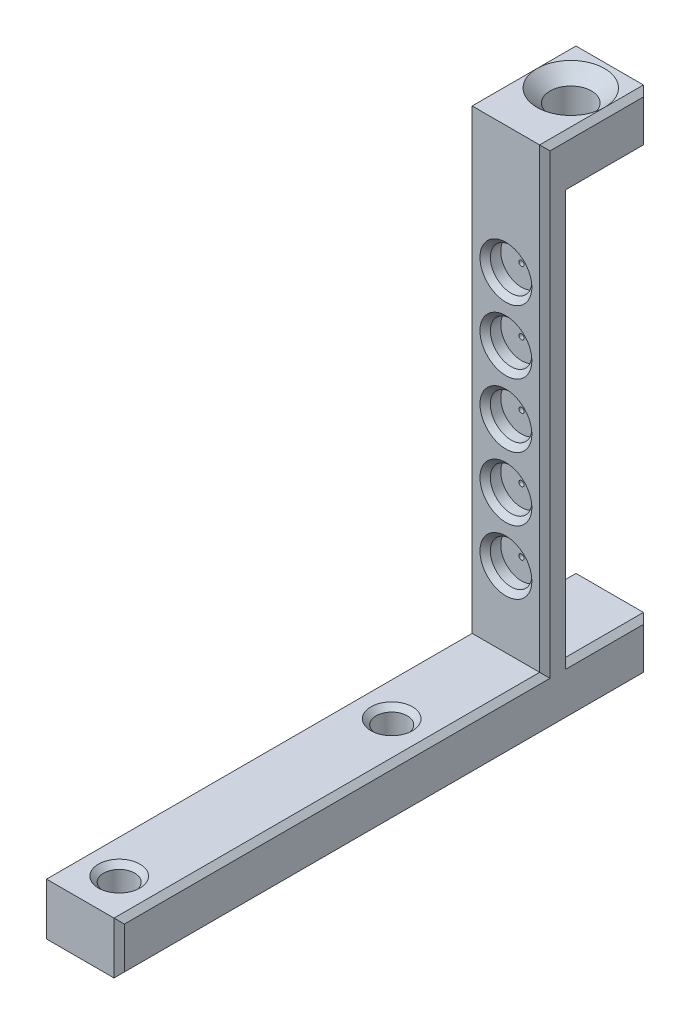
from build123d import *

# Parameters (mm, degrees)
SKETCH1_W           = 15
SKETCH1_H           = 10
SKETCH1_H_2         = 78
BOSS_EXTRUDE1_DEPTH = 5
SKETCH1_3_W         = 15
SKETCH1_3_H         = 10
BOSS_EXTRUDE2_DEPTH = 15
HOLE1_D             = 1
HOLE1_CBORE_D       = 8
HOLE1_CBORE_DEPTH   = 3
SKETCH1_4_W         = 15
SKETCH1_4_H         = 10
BOSS_EXTRUDE3_DEPTH = 87
HOLE2_START         = 41
HOLE2_OUTLINE_R     = 4
HOLE2_DEPTH         = 8
HOLE2_START_2       = 39
HOLE2_2_OUTLINE_R   = 0.5
HOLE2_2_DEPTH       = 2
CUT_EXTRUDE1_REACH  = 125.973
SKETCH9_R           = 3
CHAMFER1_SIZE       = 2.5
CHAMFER2_SIZE       = 1
CHAMFER3_SIZE       = 1


# Read off the part's stored shape, not the designer's step: Hole2
with BuildPart() as part:
    # Sketch1 → Boss-Extrude1 (new body)
    with BuildSketch(Plane.XY):
        with Locations((0, -44)):
            Rectangle(SKETCH1_W, SKETCH1_H)
        Rectangle(SKETCH1_W, SKETCH1_H_2)
        with Locations((0, 44)):
            Rectangle(SKETCH1_W, SKETCH1_H)
    extrude(amount=BOSS_EXTRUDE1_DEPTH)

    # Sketch1<3> → Boss-Extrude2 (add)
    with BuildSketch(Plane.XY):
        with Locations((0, -44)):
            Rectangle(SKETCH1_3_W, SKETCH1_3_H)
        with Locations((0, 44)):
            Rectangle(SKETCH1_3_W, SKETCH1_3_H)
    extrude(amount=-BOSS_EXTRUDE2_DEPTH)

    # Hole1 (through all)
    with Locations(Plane.XY.offset(5)):
        with Locations((0, 24.5), (0, 12.25), (0, 0), (0, -12.25), (0, -24.5)):
            CounterBoreHole(HOLE1_D / 2, HOLE1_CBORE_D / 2, HOLE1_CBORE_DEPTH)

    # Sketch1<4> → Boss-Extrude3 (add)
    with BuildSketch(Plane.XY):
        with Locations((0, -44)):
            Rectangle(SKETCH1_4_W, SKETCH1_4_H)
    extrude(amount=BOSS_EXTRUDE3_DEPTH)

    # Hole2 outline → Hole2 (cut)
    with BuildSketch(Plane(origin=(0, 0, 0), x_dir=(1, 0, 0), z_dir=(0, 1, 0)).offset(HOLE2_START)):
        with Locations((0, 7.5)):
            Circle(HOLE2_OUTLINE_R)
    extrude(amount=HOLE2_DEPTH, mode=Mode.SUBTRACT)

    # Hole2 2 outline → Hole2 2 (cut)
    with BuildSketch(Plane(origin=(0, 0, 0), x_dir=(1, 0, 0), z_dir=(0, 1, 0)).offset(HOLE2_START_2)):
        with Locations((0, 7.5)):
            Circle(HOLE2_2_OUTLINE_R)
    extrude(amount=HOLE2_2_DEPTH, mode=Mode.SUBTRACT)

    # Sketch9 → Cut-Extrude1 (cut, up to next)
    with BuildSketch(Plane(origin=(0, -39, 0), x_dir=(1, 0, 0), z_dir=(0, 1, 0)), mode=Mode.PRIVATE) as cut_extrude1_sk1:
        with Locations(Location((0, -27, 0), (0, 0, 270))):
            Circle(SKETCH9_R)
    cut_extrude1_tool1 = extrude(cut_extrude1_sk1.sketch, amount=-CUT_EXTRUDE1_REACH, mode=Mode.PRIVATE) & part.part
    # Sketch9 → Cut-Extrude1 (cut, up to next)
    with BuildSketch(Plane(origin=(0, -39, 0), x_dir=(1, 0, 0), z_dir=(0, 1, 0)), mode=Mode.PRIVATE) as cut_extrude1_sk2:
        with Locations(Location((0, -79.5, 0), (0, 0, 270))):
            Circle(SKETCH9_R)
    cut_extrude1_tool2 = extrude(cut_extrude1_sk2.sketch, amount=-CUT_EXTRUDE1_REACH, mode=Mode.PRIVATE) & part.part
    add(cut_extrude1_tool1.solids().sort_by_distance((0, -39, 27))[0], mode=Mode.SUBTRACT)
    add(cut_extrude1_tool2.solids().sort_by_distance((0, -39, 79.5))[0], mode=Mode.SUBTRACT)

    # Chamfer1
    chamfer1_edges = [part.edges().sort_by_distance(p)[0] for p in [
        (-4, 49, -7.5),
    ]]
    chamfer(chamfer1_edges, length=CHAMFER1_SIZE)

    # Chamfer2
    chamfer2_edges = [part.edges().sort_by_distance(p)[0] for p in [
        (0, -39, 76.5),
        (0, -39, 24),
        (-4, -24.5, 5),
        (-4, -12.25, 5),
        (-4, 0, 5),
        (-4, 12.25, 5),
        (-4, 24.5, 5),
    ]]
    chamfer(chamfer2_edges, length=CHAMFER2_SIZE)

    # Chamfer3
    chamfer3_edges = [part.edges().sort_by_distance(p)[0] for p in [
        (7.5, -49, 36),
        (-7.5, -39, 46),
        (-7.5, -44, 87),
        (-7.5, -49, 36),
        (-7.5, 49, -5),
        (7.5, 49, -5),
        (-7.5, 5, 5),
        (7.5, -39, -7.5),
        (-7.5, -44, -15),
        (-7.5, -39, -7.5),
        (7.5, -44, -15),
        (-7.5, 0, 0),
        (7.5, 0, 0),
        (7.5, 39, -7.5),
        (-7.5, 39, -7.5),
        (7.5, 44, -15),
        (-7.5, 44, -15),
        (7.5, 5, 5),
        (7.5, -44, 87),
        (7.5, -39, 46),
    ]]
    chamfer(chamfer3_edges, length=CHAMFER3_SIZE - 0.0001)  # a hair under: the kernel refuses the full size


solid = part.part
